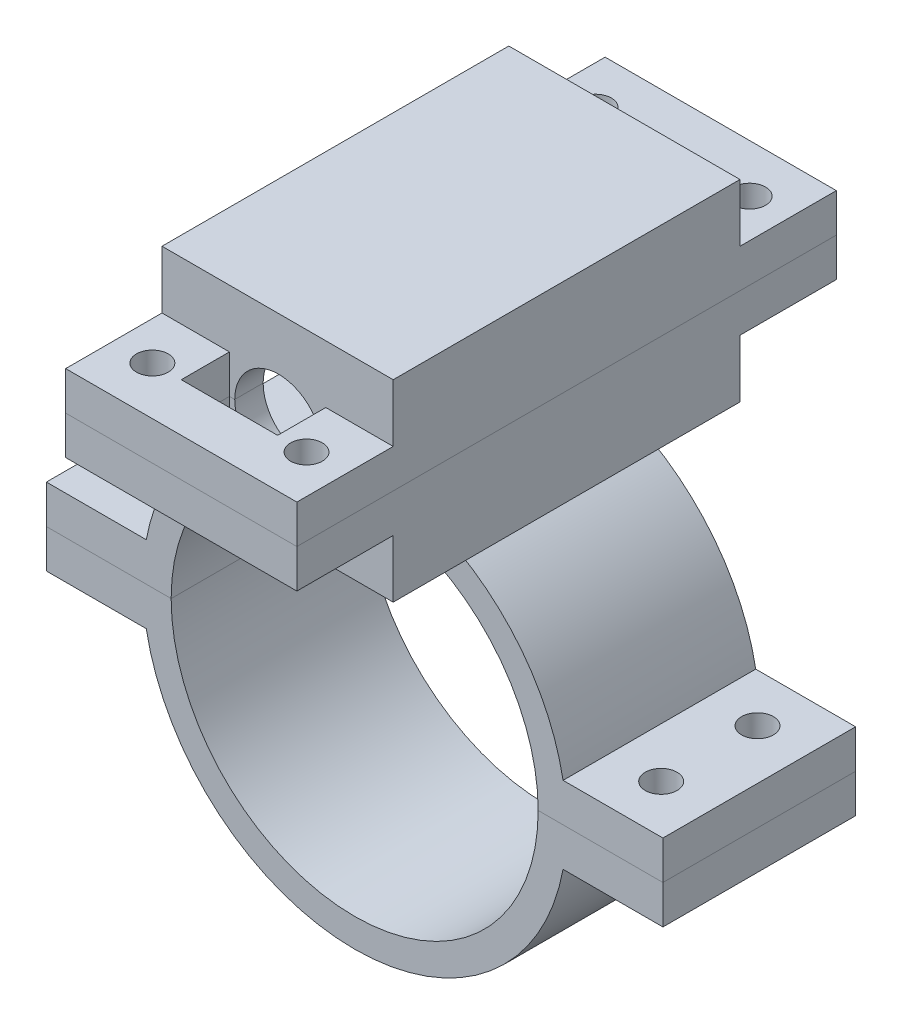
from build123d import *

# Parameters (mm, degrees)
SKETCH_1_R           = 22
SKETCH_1_R_2         = 19.05
EXTRUDE_1_DEPTH      = 20
EXTRUDE_2_DEPTH      = 4
EXTRUDE_2_DEPTH_BACK = 4
SKETCH_2_W           = 12
SKETCH_2_H           = 20
CUT_EXTRUDE_1_REACH  = 47.826
SKETCH_3_R           = 1.65
EXTRUDE_3_DEPTH      = 8
EXTRUDE_3_DEPTH_BACK = 28
SKETCH_4_W           = 24
SKETCH_4_H           = 20
SKETCH_5_W           = 30.1
SKETCH_5_H           = 15.2
CUT_EXTRUDE_2_DEPTH  = 22
CUT_EXTRUDE_3_REACH  = 64.102
SKETCH_6_R           = 4.55
EXTRUDE_4_DEPTH      = 4
EXTRUDE_4_DEPTH_BACK = 4
SKETCH_7_W           = 24
SKETCH_7_H           = 10
CUT_EXTRUDE_4_REACH  = 76.263
SKETCH_8_R           = 1.65
SKETCH_8_W           = 10
SKETCH_8_H           = 5


# Read off the part's stored shape, not the designer's step: 部品分割2
with BuildPart() as part:
    # ｽｹｯﾁ1 → ﾎﾞｽ - 押し出し1 (new body)
    with BuildSketch(Plane.XY):
        Circle(SKETCH_1_R)
        Circle(SKETCH_1_R_2, mode=Mode.SUBTRACT)
    extrude(amount=EXTRUDE_1_DEPTH)

    # ｽｹｯﾁ2 → ﾎﾞｽ - 押し出し2 (add, two sides: drawn at the far end of the back side and taken through both)
    with BuildSketch(Plane(origin=(0, 0, 0), x_dir=(1, 0, 0), z_dir=(0, 1, 0)).offset(-EXTRUDE_2_DEPTH_BACK)):
        with Locations((-26, -10)):
            Rectangle(SKETCH_2_W, SKETCH_2_H)
        with Locations((26, -10)):
            Rectangle(SKETCH_2_W, SKETCH_2_H)
    extrude(amount=EXTRUDE_2_DEPTH + EXTRUDE_2_DEPTH_BACK)

    # ｽｹｯﾁ3 → ｶｯﾄ - 押し出し1 (cut, up to next)
    with BuildSketch(Plane(origin=(0, 4, 0), x_dir=(1, 0, 0), z_dir=(0, 1, 0)), mode=Mode.PRIVATE) as cut_extrude_1_sk1:
        with Locations(Location((-26.816653826, -5, 0), (0, 0, 270))):
            Circle(SKETCH_3_R)
    cut_extrude_1_tool1 = extrude(cut_extrude_1_sk1.sketch, amount=-CUT_EXTRUDE_1_REACH, mode=Mode.PRIVATE) & part.part
    # ｽｹｯﾁ3 → ｶｯﾄ - 押し出し1 (cut, up to next)
    with BuildSketch(Plane(origin=(0, 4, 0), x_dir=(1, 0, 0), z_dir=(0, 1, 0)), mode=Mode.PRIVATE) as cut_extrude_1_sk2:
        with Locations(Location((-26.816653826, -15, 0), (0, 0, 270))):
            Circle(SKETCH_3_R)
    cut_extrude_1_tool2 = extrude(cut_extrude_1_sk2.sketch, amount=-CUT_EXTRUDE_1_REACH, mode=Mode.PRIVATE) & part.part
    # ｽｹｯﾁ3 → ｶｯﾄ - 押し出し1 (cut, up to next)
    with BuildSketch(Plane(origin=(0, 4, 0), x_dir=(1, 0, 0), z_dir=(0, 1, 0)), mode=Mode.PRIVATE) as cut_extrude_1_sk3:
        with Locations(Location((26.816653826, -15, 0), (0, 0, 270))):
            Circle(SKETCH_3_R)
    cut_extrude_1_tool3 = extrude(cut_extrude_1_sk3.sketch, amount=-CUT_EXTRUDE_1_REACH, mode=Mode.PRIVATE) & part.part
    # ｽｹｯﾁ3 → ｶｯﾄ - 押し出し1 (cut, up to next)
    with BuildSketch(Plane(origin=(0, 4, 0), x_dir=(1, 0, 0), z_dir=(0, 1, 0)), mode=Mode.PRIVATE) as cut_extrude_1_sk4:
        with Locations(Location((26.816653826, -5, 0), (0, 0, 270))):
            Circle(SKETCH_3_R)
    cut_extrude_1_tool4 = extrude(cut_extrude_1_sk4.sketch, amount=-CUT_EXTRUDE_1_REACH, mode=Mode.PRIVATE) & part.part
    add(cut_extrude_1_tool1.solids().sort_by_distance((-26.816654, 4, 5))[0], mode=Mode.SUBTRACT)
    add(cut_extrude_1_tool2.solids().sort_by_distance((-26.816654, 4, 15))[0], mode=Mode.SUBTRACT)
    add(cut_extrude_1_tool3.solids().sort_by_distance((26.816654, 4, 15))[0], mode=Mode.SUBTRACT)
    add(cut_extrude_1_tool4.solids().sort_by_distance((26.816654, 4, 5))[0], mode=Mode.SUBTRACT)

    # ｽｹｯﾁ4 → ﾎﾞｽ - 押し出し3 (add, two sides: drawn at the far end of the back side and taken through both)
    with BuildSketch(Plane(origin=(0, 0, 0), x_dir=(-1, 0, 0), z_dir=(0, 0, -1)).offset(-EXTRUDE_3_DEPTH_BACK)):
        with Locations((0, 29.2)):
            Rectangle(SKETCH_4_W, SKETCH_4_H)
    extrude(amount=EXTRUDE_3_DEPTH + EXTRUDE_3_DEPTH_BACK)

    # ｽｹｯﾁ5 → ｶｯﾄ - 押し出し2 (cut)
    with BuildSketch(Plane.ZY.offset(12)):
        with Locations((10, 29.2)):
            Rectangle(SKETCH_5_W, SKETCH_5_H)
    extrude(amount=-CUT_EXTRUDE_2_DEPTH, mode=Mode.SUBTRACT)

    # ｶｯﾄ - 押し出し3: up to this face of the body (flat: up to its plane)
    cut_extrude_3_end = Plane(part.part.faces().sort_by_distance((0, 29.2, 28))[0])
    # ｽｹｯﾁ6 → ｶｯﾄ - 押し出し3 (cut, up to the picked face)
    with BuildSketch(Plane(origin=(0, 0, -8), x_dir=(-1, 0, 0), z_dir=(0, 0, -1)), mode=Mode.PRIVATE) as cut_extrude_3_sk1:
        with Locations((-0.1, 29.2)):
            Circle(SKETCH_6_R)
    cut_extrude_3_tool1 = split(extrude(cut_extrude_3_sk1.sketch, amount=-CUT_EXTRUDE_3_REACH, mode=Mode.PRIVATE), bisect_by=cut_extrude_3_end, keep=Keep.BOTH, mode=Mode.PRIVATE)
    add(cut_extrude_3_tool1.solids().sort_by(Axis((0.1, 29.2, -8), (0, 0, 1)))[0], mode=Mode.SUBTRACT)

    # ｽｹｯﾁ7 → ﾎﾞｽ - 押し出し4 (add, two sides: drawn at the far end of the back side and taken through both)
    with BuildSketch(Plane(origin=(0, 29.2, 0), x_dir=(1, 0, 0), z_dir=(0, 1, 0)).offset(-EXTRUDE_4_DEPTH_BACK)):
        with Locations((0, 13)):
            Rectangle(SKETCH_7_W, SKETCH_7_H)
        with Locations((0, -33)):
            Rectangle(SKETCH_7_W, SKETCH_7_H)
    extrude(amount=EXTRUDE_4_DEPTH + EXTRUDE_4_DEPTH_BACK)

    # ｽｹｯﾁ8 → ｶｯﾄ - 押し出し4 (cut, up to next)
    with BuildSketch(Plane(origin=(0, 33.2, 0), x_dir=(1, 0, 0), z_dir=(0, 1, 0)), mode=Mode.PRIVATE) as cut_extrude_4_sk1:
        with Locations(Location((-8, 13, 0), (0, 0, 270))):
            Circle(SKETCH_8_R)
    cut_extrude_4_tool1 = extrude(cut_extrude_4_sk1.sketch, amount=-CUT_EXTRUDE_4_REACH, mode=Mode.PRIVATE) & part.part
    # ｽｹｯﾁ8 → ｶｯﾄ - 押し出し4 (cut, up to next)
    with BuildSketch(Plane(origin=(0, 33.2, 0), x_dir=(1, 0, 0), z_dir=(0, 1, 0)), mode=Mode.PRIVATE) as cut_extrude_4_sk2:
        with Locations(Location((8, 13, 0), (0, 0, 270))):
            Circle(SKETCH_8_R)
    cut_extrude_4_tool2 = extrude(cut_extrude_4_sk2.sketch, amount=-CUT_EXTRUDE_4_REACH, mode=Mode.PRIVATE) & part.part
    # ｽｹｯﾁ8 → ｶｯﾄ - 押し出し4 (cut, up to next)
    with BuildSketch(Plane(origin=(0, 33.2, 0), x_dir=(1, 0, 0), z_dir=(0, 1, 0)), mode=Mode.PRIVATE) as cut_extrude_4_sk3:
        with Locations(Location((8, -33, 0), (0, 0, 270))):
            Circle(SKETCH_8_R)
    cut_extrude_4_tool3 = extrude(cut_extrude_4_sk3.sketch, amount=-CUT_EXTRUDE_4_REACH, mode=Mode.PRIVATE) & part.part
    # ｽｹｯﾁ8 → ｶｯﾄ - 押し出し4 (cut, up to next)
    with BuildSketch(Plane(origin=(0, 33.2, 0), x_dir=(1, 0, 0), z_dir=(0, 1, 0)), mode=Mode.PRIVATE) as cut_extrude_4_sk4:
        with Locations(Location((-8, -33, 0), (0, 0, 270))):
            Circle(SKETCH_8_R)
    cut_extrude_4_tool4 = extrude(cut_extrude_4_sk4.sketch, amount=-CUT_EXTRUDE_4_REACH, mode=Mode.PRIVATE) & part.part
    # ｽｹｯﾁ8 → ｶｯﾄ - 押し出し4 (cut, up to next)
    with BuildSketch(Plane(origin=(0, 33.2, 0), x_dir=(1, 0, 0), z_dir=(0, 1, 0)), mode=Mode.PRIVATE) as cut_extrude_4_sk5:
        with Locations((0, 10.5)):
            Rectangle(SKETCH_8_W, SKETCH_8_H)
    cut_extrude_4_tool5 = extrude(cut_extrude_4_sk5.sketch, amount=-CUT_EXTRUDE_4_REACH, mode=Mode.PRIVATE) & part.part
    # ｽｹｯﾁ8 → ｶｯﾄ - 押し出し4 (cut, up to next)
    with BuildSketch(Plane(origin=(0, 33.2, 0), x_dir=(1, 0, 0), z_dir=(0, 1, 0)), mode=Mode.PRIVATE) as cut_extrude_4_sk6:
        with Locations((0, -30.5)):
            Rectangle(SKETCH_8_W, SKETCH_8_H)
    cut_extrude_4_tool6 = extrude(cut_extrude_4_sk6.sketch, amount=-CUT_EXTRUDE_4_REACH, mode=Mode.PRIVATE) & part.part
    add(cut_extrude_4_tool1.solids().sort_by_distance((-8, 33.2, -13))[0], mode=Mode.SUBTRACT)
    add(cut_extrude_4_tool2.solids().sort_by_distance((8, 33.2, -13))[0], mode=Mode.SUBTRACT)
    add(cut_extrude_4_tool3.solids().sort_by_distance((8, 33.2, 33))[0], mode=Mode.SUBTRACT)
    add(cut_extrude_4_tool4.solids().sort_by_distance((-8, 33.2, 33))[0], mode=Mode.SUBTRACT)
    add(cut_extrude_4_tool5.solids().sort_by_distance((0, 33.2, -10.5))[0], mode=Mode.SUBTRACT)
    add(cut_extrude_4_tool6.solids().sort_by_distance((0, 33.2, 30.5))[0], mode=Mode.SUBTRACT)


with BuildPart() as body_2:
    # Split Bodies 1: the piece on the far side of the plane
    add(part.part)
    split(bisect_by=Plane.ZX.offset(29.2), keep=Keep.BOTTOM)


with BuildPart() as part_1:
    add(part.part)

    # Split Bodies 1
    split(bisect_by=Plane.ZX.offset(29.2), keep=Keep.TOP)


with BuildPart() as body_3:
    # Split Bodies 2: the piece on the far side of the plane
    add(body_2.part)
    split(bisect_by=Plane(origin=(0, 0, 0), x_dir=(1, 0, 0), z_dir=(0, 1, 0)), keep=Keep.BOTTOM)


with BuildPart() as body_2_1:
    add(body_2.part)

    # Split Bodies 2
    split(bisect_by=Plane(origin=(0, 0, 0), x_dir=(1, 0, 0), z_dir=(0, 1, 0)), keep=Keep.TOP)


solid = Compound([part_1.part, body_3.part, body_2_1.part])
